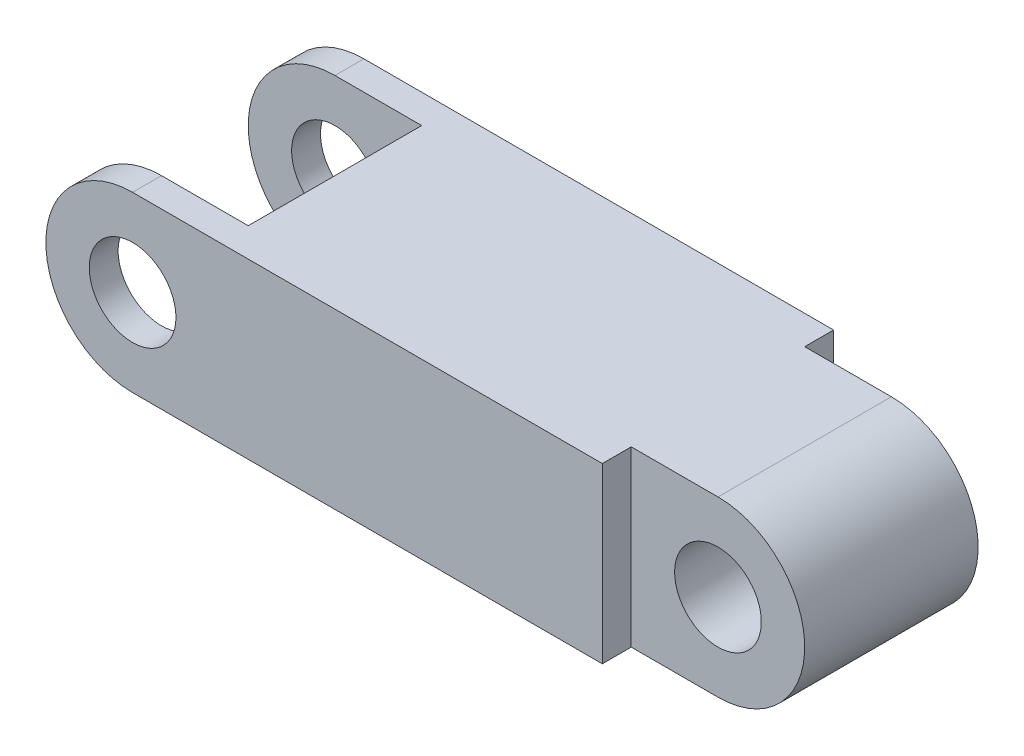
from build123d import *

# Parameters (mm, degrees)
SKETCH1_R           = 7.5
BOSS_EXTRUDE1_DEPTH = 40
SKETCH2_W           = 30
SKETCH2_H           = 30
SKETCH2_H_2         = 5
CUT_EXTRUDE1_DEPTH  = 122.962291437


with BuildPart() as part:
    # Sketch1 → Boss-Extrude1 (new body)
    with BuildSketch(Plane.XY):
        with BuildLine():
            Line((0, 15), (96.242080764, 15))
            ThreePointArc((96.242080764, 15), (111.242080764, 0), (96.242080764, -15))
            Line((96.242080764, -15), (0, -15))
            ThreePointArc((0, -15), (-15, 0), (0, 15))
        make_face()
        Circle(SKETCH1_R, mode=Mode.SUBTRACT)
        with Locations((96.242080764, 0)):
            Circle(SKETCH1_R, mode=Mode.SUBTRACT)
    extrude(amount=BOSS_EXTRUDE1_DEPTH)

    # Sketch2 → Cut-Extrude1 (cut, through all)
    with BuildSketch(Plane(origin=(0, 15, 0), x_dir=(1, 0, 0), z_dir=(0, 1, 0))):
        with Locations((0, -20)):
            Rectangle(SKETCH2_W, SKETCH2_H)
        with Locations((96.242080764, -2.5)):
            Rectangle(SKETCH2_W, SKETCH2_H_2)
        with Locations((96.242080764, -37.5)):
            Rectangle(SKETCH2_W, SKETCH2_H_2)
    extrude(amount=-CUT_EXTRUDE1_DEPTH, mode=Mode.SUBTRACT)


solid = part.part
